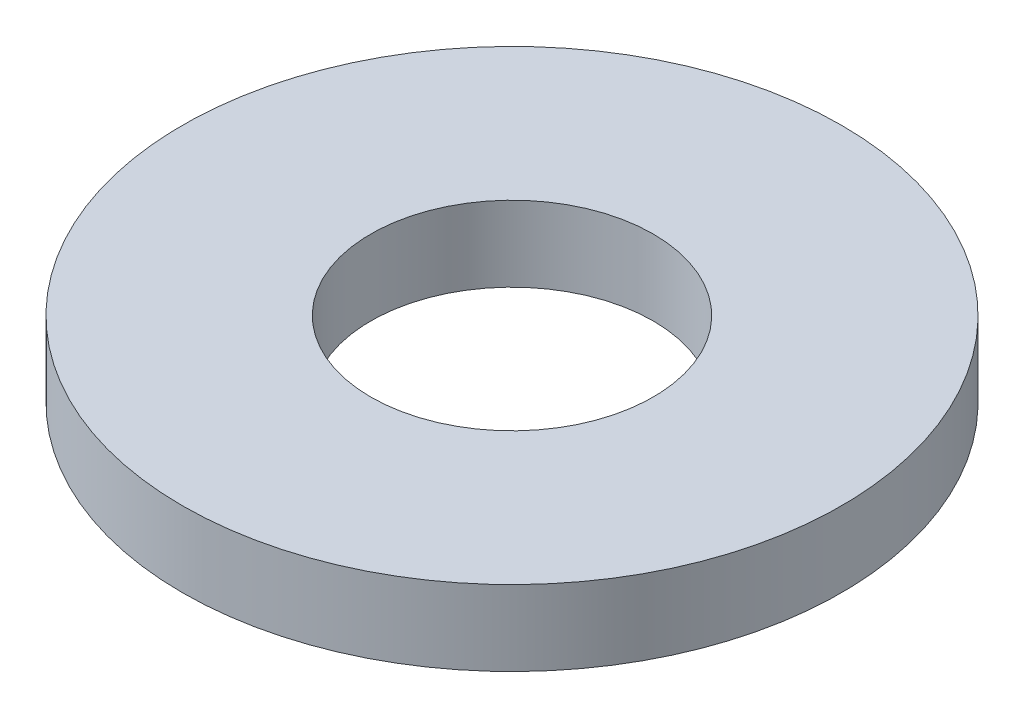
from build123d import *

# Parameters (mm, degrees)
SKETCH1_R           = 70
BOSS_EXTRUDE1_DEPTH = 16
SKETCH2_R           = 30
CUT_EXTRUDE1_DEPTH  = 101.279609094


with BuildPart() as part:
    # Sketch1 → Boss-Extrude1 (new body)
    with BuildSketch(Plane(origin=(0, 0, 0), x_dir=(1, 0, 0), z_dir=(0, 1, 0))):
        Circle(SKETCH1_R)
    extrude(amount=BOSS_EXTRUDE1_DEPTH)

    # Sketch2 → Cut-Extrude1 (cut, through all)
    with BuildSketch(Plane(origin=(0, 0, 0), x_dir=(1, 0, 0), z_dir=(0, 1, 0))):
        Circle(SKETCH2_R)
    extrude(amount=CUT_EXTRUDE1_DEPTH, mode=Mode.SUBTRACT)


solid = part.part
